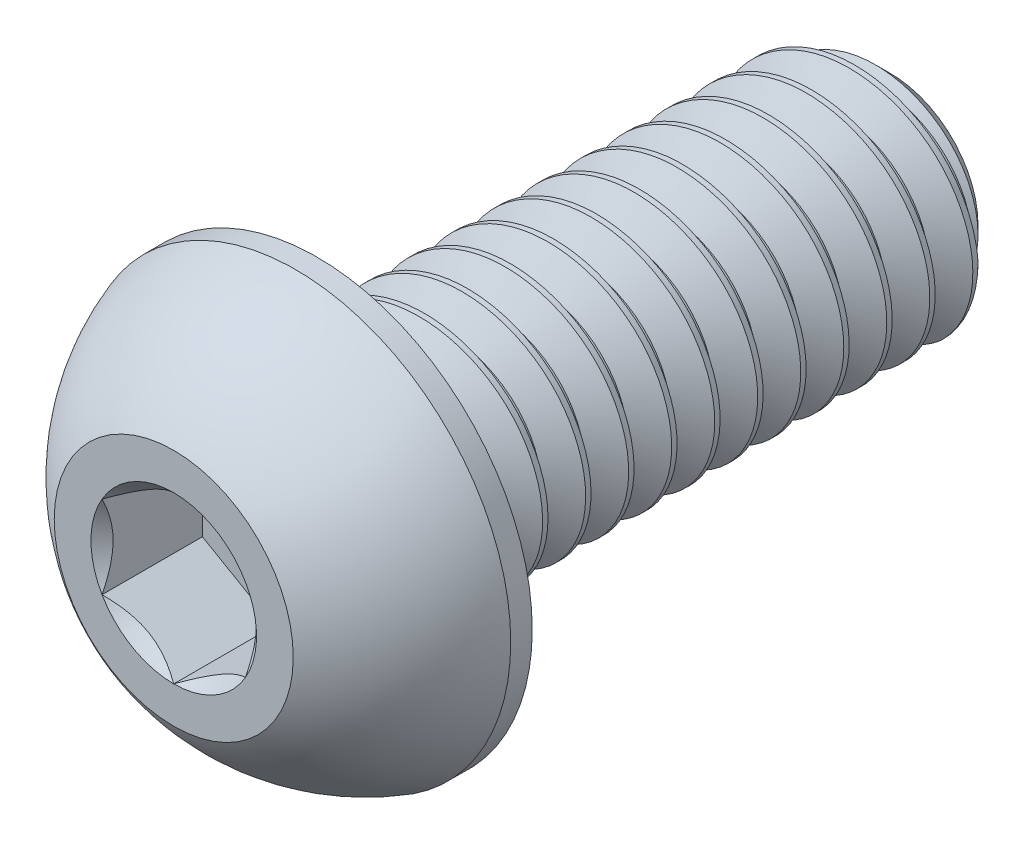
from build123d import *

# Parameters (mm, degrees)
CUT_EXTRUDE2_DEPTH = 1.05
CUT_SWEEP2_PITCH   = 0.45


# Read off the part's stored shape, not the designer's step: Split1, Boss-Extrude1
with BuildPart() as part:
    # Sketch10 → Revolve3 (revolve)
    with BuildSketch(Plane(origin=(0, 0, 0), x_dir=(0, 0, -1), z_dir=(1, 0, 0)), mode=Mode.PRIVATE) as revolve3_sk:
        Polygon((7.1625, 1.25), (7.5, 0.9125), (7.5, 0), (1.5, 0), (1.5, 1.25), align=None)
    revolve(revolve3_sk.sketch.rotate(Axis((0, 0, 0), (0, 0, -1)), 90), axis=Axis((0, 0, 0), (0, 0, -1)))

    # Sketch7 → Revolve2 (revolve)
    with BuildSketch(Plane(origin=(0, 0, 0), x_dir=(0, 0, -1), z_dir=(1, 0, 0)), mode=Mode.PRIVATE) as revolve2_sk:
        with BuildLine():
            Line((1.275, 2.25), (1.5, 2.25))
            Line((1.5, 2.25), (1.5, 0))
            Line((1.5, 0), (0, 0))
            Line((0, 0), (0, 1.25))
            ThreePointArc((0, 1.25), (0.549264706, 1.8625), (1.275, 2.25))
        make_face()
    revolve(revolve2_sk.sketch.rotate(Axis((0, 0, 0), (0, 0, -1)), 180), axis=Axis((0, 0, 0), (0, 0, -1)))

    # Sketch5 → Cut-Extrude2 (cut)
    with BuildSketch(Plane.XY):
        Polygon((0.75, -0.433012702), (0.75, 0.433012702), (0, 0.866025404), (-0.75, 0.433012702), (-0.75, -0.433012702), (0, -0.866025404), align=None)
    extrude(amount=-CUT_EXTRUDE2_DEPTH, mode=Mode.SUBTRACT)

    # Cut-Extrude3 cone 1 section (through the dimple's axis) → Cut-Extrude3 (revolve, cut)
    with BuildSketch(Plane(origin=(0, 0, 0), x_dir=(0, -1, 0), z_dir=(1, 0, 0))):
        Polygon((0, 0), (0.866025404, 0), (0, 0.866025404), align=None)
    revolve(axis=Axis((0, 0, 0), (0, 0, -1)), mode=Mode.SUBTRACT)


with BuildPart() as body_2:
    # Split1: the piece on the far side of the plane
    add(part.part)
    split(bisect_by=Plane.XY.offset(-1.5), keep=Keep.BOTTOM)

    # Cut-Sweep2: the profile of Sketch12 screwed along a right-hand helix of 16.666667 turns, 6 arcs to a turn; built about Z, then put on its axis
    cut_sweep2_z = Axis((0, 0, 0), (0, 0, 1))
    cut_sweep2_corners = [(0.957716426, 0, -0.16875), (0.957716426, 0, -0.225), (1.274356964, 0, -0.4078125), (1.274356964, 0, 0.0140625)]
    with BuildLine(mode=Mode.PRIVATE) as cut_sweep2_profile:
        Line(cut_sweep2_corners[0], cut_sweep2_corners[1])
        Line(cut_sweep2_corners[1], cut_sweep2_corners[2])
        Line(cut_sweep2_corners[2], cut_sweep2_corners[3])
        Line(cut_sweep2_corners[3], cut_sweep2_corners[0])
    cut_sweep2_cap = Face(cut_sweep2_profile.wire())
    cut_sweep2_turn_angles = [0, 30, 60, 90, 120, 150, 180, 210, 240, 270, 300, 330, 360]
    cut_sweep2_turn_weights = [1, 0.8660254037844387, 1, 0.8660254037844387, 1, 0.8660254037844387, 1, 0.8660254037844387, 1, 0.8660254037844387, 1, 0.8660254037844387, 1]
    cut_sweep2_turn_rails = [Edge.make_bspline([Vector(p[0], p[1], 0).rotate(cut_sweep2_z, cut_sweep2_turn_angles[k]) / cut_sweep2_turn_weights[k] + Vector(0, 0, p[2] + CUT_SWEEP2_PITCH * cut_sweep2_turn_angles[k] / 360) for k in range(13)], [0, 0, 0, 1, 1, 2, 2, 3, 3, 4, 4, 5, 5, 6, 6, 6], 2, cut_sweep2_turn_weights) for p in cut_sweep2_corners]
    cut_sweep2_turn_sides = [Face.make_surface_from_curves(cut_sweep2_turn_rails[p[0]], cut_sweep2_turn_rails[p[1]]) for p in [(0, 1), (1, 2), (2, 3), (3, 0)]]
    cut_sweep2_turn = Solid(Shell([*cut_sweep2_turn_sides, cut_sweep2_cap, cut_sweep2_cap.rotate(cut_sweep2_z, 360).moved(Location((0, 0, CUT_SWEEP2_PITCH * 360 / 360)))]))
    cut_sweep2_last_angles = [5760, 5790, 5820, 5850, 5880, 5910, 5940, 5970, 6000]
    cut_sweep2_last_weights = [1, 0.8660254037844387, 1, 0.8660254037844387, 1, 0.8660254037844387, 1, 0.8660254037843395, 1]
    cut_sweep2_last_rails = [Edge.make_bspline([Vector(p[0], p[1], 0).rotate(cut_sweep2_z, cut_sweep2_last_angles[k]) / cut_sweep2_last_weights[k] + Vector(0, 0, p[2] + CUT_SWEEP2_PITCH * cut_sweep2_last_angles[k] / 360) for k in range(9)], [0, 0, 0, 1, 1, 2, 2, 3, 3, 4, 4, 4], 2, cut_sweep2_last_weights) for p in cut_sweep2_corners]
    cut_sweep2_last_sides = [Face.make_surface_from_curves(cut_sweep2_last_rails[p[0]], cut_sweep2_last_rails[p[1]]) for p in [(0, 1), (1, 2), (2, 3), (3, 0)]]
    cut_sweep2_last = Solid(Shell([*cut_sweep2_last_sides, cut_sweep2_cap.rotate(cut_sweep2_z, 5760).moved(Location((0, 0, CUT_SWEEP2_PITCH * 5760 / 360))), cut_sweep2_cap.rotate(cut_sweep2_z, 6000).moved(Location((0, 0, CUT_SWEEP2_PITCH * 6000 / 360)))]))
    cut_sweep2_each = [*[cut_sweep2_turn.moved(Location((0, 0, CUT_SWEEP2_PITCH * i))) for i in range(16)], cut_sweep2_last]
    add(Plane(origin=(0, 0, -7.5), x_dir=(0, 1, 0), z_dir=(0, 0, 1)) * Compound([cut_sweep2_each[i] for i in range(0, 17, 2)]), mode=Mode.SUBTRACT)
    add(Plane(origin=(0, 0, -7.5), x_dir=(0, 1, 0), z_dir=(0, 0, 1)) * Compound([cut_sweep2_each[i] for i in range(1, 17, 2)]), mode=Mode.SUBTRACT)


with BuildPart() as part_1:
    add(part.part)

    # Split1
    split(bisect_by=Plane.XY.offset(-1.5), keep=Keep.TOP)

    add(body_2.part)  # Boss-Extrude1 merges body 2
    # Boss-Extrude1 outline → Boss-Extrude1 (revolve)
    with BuildSketch(Plane.XZ):
        Polygon((0.957712238, -1.5), (0.957712238, -1.792287762), (1.25, -1.5), align=None)
    revolve(axis=Axis((0, 0, 0), (0, 0, 1)))


solid = part_1.part
